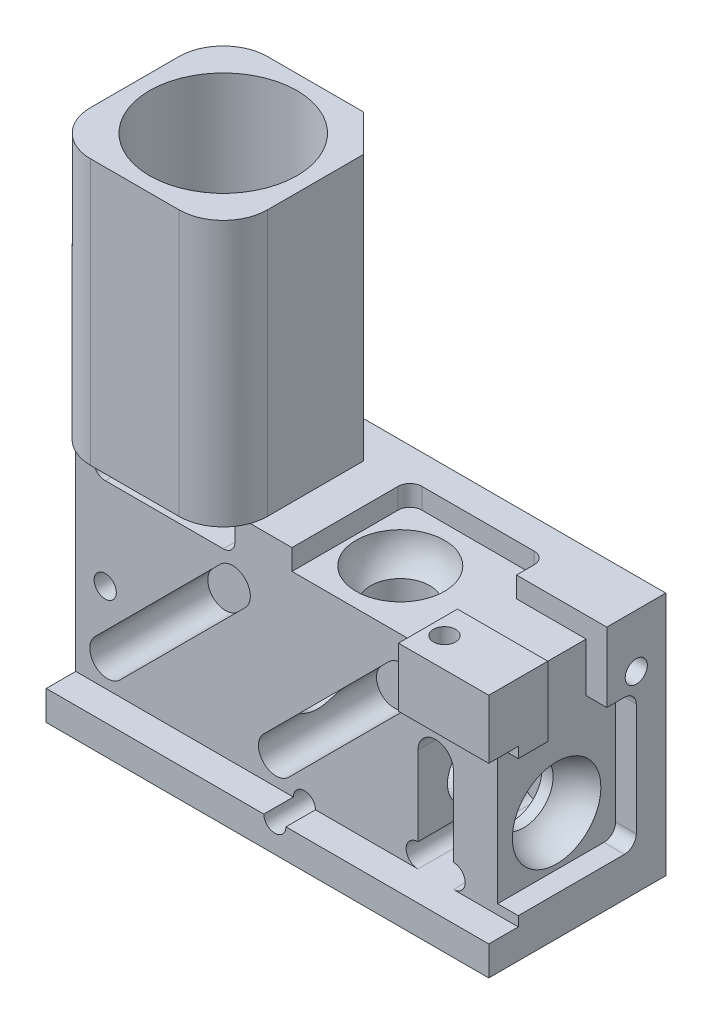
from build123d import *

# Parameters (mm, degrees)
SKETCH1_W                        = 15
SKETCH1_H                        = 6
MAIN_BODY_EXT_DEPTH              = 8.3
EMISSION_PATH_EXT_DEPTH          = 9
SKETCH3_R                        = 1.25
EMISSION_AND_GRIN_CUT_DEPTH      = 20.092931
SKETCH4_R                        = 1
DRUM_LENS_CUT_DEPTH              = 13
SKETCH41_R                       = 1
ADDTL_LIGHT_SOURCE_DEPTH         = 5
SKETCH5_W                        = 15
SKETCH5_H                        = 7.3
FILTERCOVER_CUT1_DEPTH           = 1
TOP_LED_SCREW_W                  = 3.06
TOP_LED_SCREW_H                  = 2
BOSS_EXTRUDE1_DEPTH              = 1
FILTERSET_CUT2_DEPTH             = 4
SKETCH10_R                       = 2.5
EMISSION_LENS_CUT_DEPTH          = 8.5
SKETCH15_R                       = 0.795
MAGNETS_CUT_DEPTH                = 0.9
SCREW_HOLES_CUT_DEPTH            = 20.507434
SCREW_HOLES_CUT_DEPTH_BACK       = 2.5
SKETCH18_R                       = 0.375
EXTERNAL_FILLET_1_R              = 1.5
VERTICAL_PATH_CUT_DEPTH          = 14.011149
VERTICAL_PATH_CUT_DEPTH_BACK     = 4
SKETCH28_R                       = 1.5
CUT_EXTRUDE_ORIGINAL_LIGHT_DEPTH = 0.7
CUT_EXTRUDE_ADDTL_LIGHT_DEPTH    = 0.7
SKETCH29_R                       = 0.375
SIDE_LED_SCREW_DEPTH             = 2.5
SKETCH32_W                       = 2
SKETCH32_H                       = 2.36
SIDE_WIRE_SLOT_CUT_DEPTH         = 0.7
SKETCH45_W                       = 2.36
SKETCH45_H                       = 2
TOP_LED_SLOT_DEPTH               = 0.7
CUT_EXTRUDE16_DEPTH              = 9
CUT_EXTRUDE17_REACH              = 13.945
SKETCH37_R                       = 2
SKETCH51_R                       = 0.375
TOP_LE_SCREW_DEPTH               = 2.1
CUT_EXTRUDE20_DEPTH              = 2


with BuildPart() as part:
    # Sketch1 → Main Body Ext (new body)
    with BuildSketch(Plane(origin=(0, 0, 0), x_dir=(1, 0, 0), z_dir=(0, 1, 0))):
        Rectangle(SKETCH1_W, SKETCH1_H)
    extrude(amount=MAIN_BODY_EXT_DEPTH)

    # Sketch8 → Emission Path Ext (add)
    with BuildSketch(Plane(origin=(0, 8.3, 0), x_dir=(1, 0, 0), z_dir=(0, 1, 0))):
        Polygon((-2.75, 3), (-1.5, 1.75), (-1.5, -3), (-7.5, -3), (-7.5, 3), align=None)
    extrude(amount=EMISSION_PATH_EXT_DEPTH)

    # Sketch3 → Emission and Grin Cut (cut, through all)
    with BuildSketch(Plane.XZ):
        with Locations(Location((-4.5, 0, 0), (0, 0, 270))):
            Circle(SKETCH3_R)
    extrude(amount=-EMISSION_AND_GRIN_CUT_DEPTH, mode=Mode.SUBTRACT)

    # Sketch4 → Drum Lens Cut (cut)
    with BuildSketch(Plane(origin=(7.5, 0, 0), x_dir=(0, 0, -1), z_dir=(1, 0, 0))):
        with Locations((0, 3)):
            Circle(SKETCH4_R)
    extrude(amount=-DRUM_LENS_CUT_DEPTH, mode=Mode.SUBTRACT)

    # Sketch41 → Addtl Light Source (cut)
    with BuildSketch(Plane(origin=(0, 8.3, 0), x_dir=(1, 0, 0), z_dir=(0, 1, 0))):
        with Locations(Location((1.5, 0, 0), (0, 0, 270))):
            Circle(SKETCH41_R)
    extrude(amount=-ADDTL_LIGHT_SOURCE_DEPTH, mode=Mode.SUBTRACT)

    # Sketch5 → FilterCover Cut1 (cut)
    with BuildSketch(Plane.XY.offset(3)):
        with Locations((0, 4.65)):
            Rectangle(SKETCH5_W, SKETCH5_H)
    extrude(amount=-FILTERCOVER_CUT1_DEPTH, mode=Mode.SUBTRACT)

    # Top-LED-Screw → Boss-Extrude1 (add)
    with BuildSketch(Plane.XY.offset(2)):
        with Locations((5.97, 7.3)):
            Rectangle(TOP_LED_SCREW_W, TOP_LED_SCREW_H)
    extrude(amount=BOSS_EXTRUDE1_DEPTH)

    # Sketch6 → FilterSet Cut2 (cut)
    with BuildSketch(Plane.XY.offset(2)):
        with BuildLine():
            Line((5.3, 4.5), (5.3, 1.8))
            ThreePointArc((5.3, 1.8), (5.7, 1.4), (5.3, 1))
            Line((5.3, 1), (4.1, 1))
            ThreePointArc((4.1, 1), (3.7, 1.4), (4.1, 1.8))
            Line((4.1, 1.8), (4.1, 4.5))
            ThreePointArc((4.1, 4.5), (4.7, 5.1), (5.3, 4.5))
        make_face()
        with BuildLine():
            Line((-6.9, 7.9), (-6.9, 7.5))
            ThreePointArc((-6.9, 7.5), (-6.782843, 7.217157), (-6.5, 7.1))
            Line((-6.5, 7.1), (-2.5, 7.1))
            ThreePointArc((-2.5, 7.1), (-2.217157, 7.217157), (-2.1, 7.5))
            Line((-2.1, 7.5), (-2.1, 7.9))
            ThreePointArc((-2.1, 7.9), (-2.217157, 8.182843), (-2.5, 8.3))
            Line((-2.5, 8.3), (-6.5, 8.3))
            ThreePointArc((-6.5, 8.3), (-6.782843, 8.182843), (-6.9, 7.9))
        make_face()
        with BuildLine():
            Line((-2.605887, 6.591169), (-6.848528, 2.348528))
            ThreePointArc((-6.848528, 2.348528), (-6.848528, 1.5), (-6, 1.5))
            Line((-6, 1.5), (-1.757359, 5.742641))
            ThreePointArc((-1.757359, 5.742641), (-1.757359, 6.591169), (-2.605887, 6.591169))
        make_face()
        with BuildLine():
            Line((3.112092, 6.591169), (-1.130548, 2.348528))
            ThreePointArc((-1.130548, 2.348528), (-1.130548, 1.5), (-0.28202, 1.5))
            Line((-0.28202, 1.5), (3.96062, 5.742641))
            ThreePointArc((3.96062, 5.742641), (3.96062, 6.591169), (3.112092, 6.591169))
        make_face()
    extrude(amount=-FILTERSET_CUT2_DEPTH, mode=Mode.SUBTRACT)

    # Sketch10 → Emission Lens Cut (cut)
    with BuildSketch(Plane(origin=(0, 17.3, 0), x_dir=(1, 0, 0), z_dir=(0, 1, 0))):
        with Locations(Location((-4.5, 0, 0), (0, 0, 270))):
            Circle(SKETCH10_R)
    extrude(amount=-EMISSION_LENS_CUT_DEPTH, mode=Mode.SUBTRACT)

    # Sketch15 → Magnets Cut (cut)
    with BuildSketch(Plane.XZ):
        with Locations(Location((-6.25, -1.875, 0), (0, 0, 270))):
            Circle(SKETCH15_R)
        with Locations(Location((-6.25, 1.875, 0), (0, 0, 270))):
            Circle(SKETCH15_R)
        with Locations(Location((-1.5, 0, 0), (0, 0, 270))):
            Circle(SKETCH15_R)
    extrude(amount=-MAGNETS_CUT_DEPTH, mode=Mode.SUBTRACT)

    # Sketch18 → Screw Holes Cut (cut, two sides: drawn at the far end of the back side and taken through both)
    with BuildSketch(Plane.XY.offset(2).offset(-SCREW_HOLES_CUT_DEPTH_BACK)):
        with Locations(Location((-6.5, 4, 0), (0, 0, 180))):
            Circle(SKETCH18_R)
        with Locations(Location((6, 5.8, 0), (0, 0, 180))):
            Circle(SKETCH18_R)
        with Locations((0.25, 1)):
            Circle(SKETCH18_R)
    extrude(amount=SCREW_HOLES_CUT_DEPTH + SCREW_HOLES_CUT_DEPTH_BACK, mode=Mode.SUBTRACT)

    # External Fillet 1
    # the kernel refuses this fillet: 1.5 mm, written as the material it takes off along each edge
    with BuildSketch(Plane(origin=(-7.5, -3.75, -3), x_dir=(1, 0, 0), z_dir=(0, 1, 0))) as external_fillet_1_piece_1:
        with BuildLine():
            CenterArc((EXTERNAL_FILLET_1_R, -EXTERNAL_FILLET_1_R), EXTERNAL_FILLET_1_R, 90, 90)
            Line((0, -EXTERNAL_FILLET_1_R), (0, 0))
            Line((0, 0), (EXTERNAL_FILLET_1_R, 0))
        make_face()
    extrude(amount=24.8, mode=Mode.SUBTRACT)
    with BuildSketch(Plane(origin=(-1.5, 8.3, 3), x_dir=(0, 0, -1), z_dir=(0, 1, 0))) as external_fillet_1_piece_2:
        with BuildLine():
            CenterArc((EXTERNAL_FILLET_1_R, EXTERNAL_FILLET_1_R), EXTERNAL_FILLET_1_R, 180, 90)
            Line((0, EXTERNAL_FILLET_1_R), (0, 0))
            Line((0, 0), (EXTERNAL_FILLET_1_R, 0))
        make_face()
    extrude(amount=12.75, mode=Mode.SUBTRACT)

    # Sketch28 → Vertical-Path-Cut (cut, two sides: drawn at the far end of the back side and taken through both)
    with BuildSketch(Plane(origin=(0, 7.1, 0), x_dir=(1, 0, 0), z_dir=(0, 1, 0)).offset(-VERTICAL_PATH_CUT_DEPTH_BACK)):
        with Locations(Location((-4.5, 0, 0), (0, 0, 180))):
            Circle(SKETCH28_R)
    extrude(amount=VERTICAL_PATH_CUT_DEPTH + VERTICAL_PATH_CUT_DEPTH_BACK, mode=Mode.SUBTRACT)

    # Sketch12 → Cut-Extrude Original Light (cut)
    with BuildSketch(Plane(origin=(7.5, 0, 0), x_dir=(0, 0, -1), z_dir=(1, 0, 0))):
        with BuildLine():
            Line((1.6, 5.94), (-1.6, 5.94))
            Line((-1.6, 5.94), (-2, 5.94))
            Line((-2, 5.94), (-2, 1.33))
            Line((-2, 1.33), (1.6, 1.33))
            ThreePointArc((1.6, 1.33), (1.882843, 1.447157), (2, 1.73))
            Line((2, 1.73), (2, 5.54))
            ThreePointArc((2, 5.54), (1.882843, 5.822843), (1.6, 5.94))
        make_face()
    extrude(amount=-CUT_EXTRUDE_ORIGINAL_LIGHT_DEPTH, mode=Mode.SUBTRACT)

    # Sketch44 → Cut-Extrude Addtl Light (cut)
    with BuildSketch(Plane(origin=(0, 8.3, 0), x_dir=(1, 0, 0), z_dir=(0, 1, 0))):
        with BuildLine():
            Line((-0.17, -2), (4.44, -2))
            Line((4.44, -2), (4.44, 1.6))
            ThreePointArc((4.44, 1.6), (4.322843, 1.882843), (4.04, 2))
            Line((4.04, 2), (0.23, 2))
            ThreePointArc((0.23, 2), (-0.052843, 1.882843), (-0.17, 1.6))
            Line((-0.17, 1.6), (-0.17, -2))
        make_face()
    extrude(amount=-CUT_EXTRUDE_ADDTL_LIGHT_DEPTH, mode=Mode.SUBTRACT)

    # Sketch29 → Side-LED-Screw (cut)
    with BuildSketch(Plane(origin=(7.5, 0, 0), x_dir=(0, 0, -1), z_dir=(1, 0, 0))):
        with Locations((2, 6.5)):
            Circle(SKETCH29_R)
    extrude(amount=-SIDE_LED_SCREW_DEPTH, mode=Mode.SUBTRACT)

    # Sketch32 → Side-Wire-Slot-Cut (cut)
    with BuildSketch(Plane(origin=(7.5, 0, 0), x_dir=(0, 0, -1), z_dir=(1, 0, 0))):
        with Locations((0, 7.12)):
            Rectangle(SKETCH32_W, SKETCH32_H)
    extrude(amount=-SIDE_WIRE_SLOT_CUT_DEPTH, mode=Mode.SUBTRACT)

    # Sketch45 → Top-LED-slot (cut)
    with BuildSketch(Plane(origin=(0, 8.3, 0), x_dir=(1, 0, 0), z_dir=(0, 1, 0))):
        with Locations((5.62, 0)):
            Rectangle(SKETCH45_W, SKETCH45_H)
    extrude(amount=-TOP_LED_SLOT_DEPTH, mode=Mode.SUBTRACT)

    # Sketch33 → Side-BallLens_Cut (revolve, cut)
    with BuildSketch(Plane.XY, mode=Mode.PRIVATE) as side_balllens_cut_sk:
        with BuildLine():
            Line((6.8, 3), (5.3, 3))
            ThreePointArc((5.3, 3), (5.73934, 4.06066), (6.8, 4.5))
            Line((6.8, 4.5), (6.8, 3))
        make_face()
    revolve(side_balllens_cut_sk.sketch.rotate(Axis((6.8, 3, 0), (-1, 0, 0)), 84.26086), axis=Axis((6.8, 3, 0), (-1, 0, 0)), mode=Mode.SUBTRACT)

    # Sketch47 → Top-BallLens_Cut (revolve, cut)
    with BuildSketch(Plane(origin=(1.5, 0, 0), x_dir=(0, 0, -1), z_dir=(1, 0, 0))):
        with BuildLine():
            Line((-1.5, 7.6), (0, 7.6))
            Line((0, 7.6), (0, 6.137287))
            ThreePointArc((0, 6.137287), (-1.04756, 6.563498), (-1.5, 7.6))
        make_face()
    revolve(axis=Axis((1.5, 7.6, 0), (0, -1, 0)), mode=Mode.SUBTRACT)

    # Sketch36 → Cut-Extrude16 (cut)
    with BuildSketch(Plane(origin=(0, 17.3, 0), x_dir=(1, 0, 0), z_dir=(0, 1, 0))):
        with BuildLine():
            Line((-7.5, -1.5), (-7.5, -3))
            Line((-7.5, -3), (-6, -3))
            ThreePointArc((-6, -3), (-7.06066, -2.56066), (-7.5, -1.5))
        make_face()
    extrude(amount=-CUT_EXTRUDE16_DEPTH, mode=Mode.SUBTRACT)

    # Sketch37 → Cut-Extrude17 (cut, up to next)
    with BuildSketch(Plane(origin=(0, 8.8, 0), x_dir=(1, 0, 0), z_dir=(0, 1, 0)), mode=Mode.PRIVATE) as cut_extrude17_sk1:
        with Locations(Location((-4.5, 0, 0), (0, 0, 180))):
            Circle(SKETCH37_R)
    cut_extrude17_tool1 = extrude(cut_extrude17_sk1.sketch, amount=-CUT_EXTRUDE17_REACH, mode=Mode.PRIVATE) & part.part
    add(cut_extrude17_tool1.solids().sort_by_distance((-4.5, 8.8, 0))[0], mode=Mode.SUBTRACT)

    # Sketch51 → Top-LE-Screw (cut)
    with BuildSketch(Plane(origin=(0, 8.3, 0), x_dir=(1, 0, 0), z_dir=(0, 1, 0))):
        with Locations(Location((5, -2, 0), (0, 0, 270))):
            Circle(SKETCH51_R)
    extrude(amount=-TOP_LE_SCREW_DEPTH, mode=Mode.SUBTRACT)

    # Notch → Cut-Extrude20 (cut)
    with BuildSketch(Plane.XZ):
        Polygon((3.181665, -1.6476), (1.6516, -1.6476), (1.6516, -3), (5.210265, -3), align=None)
        Polygon((1.6516, -3), (1.6516, -1.6476), (0.75, -3), align=None)
    extrude(amount=-CUT_EXTRUDE20_DEPTH, mode=Mode.SUBTRACT)


solid = part.part
